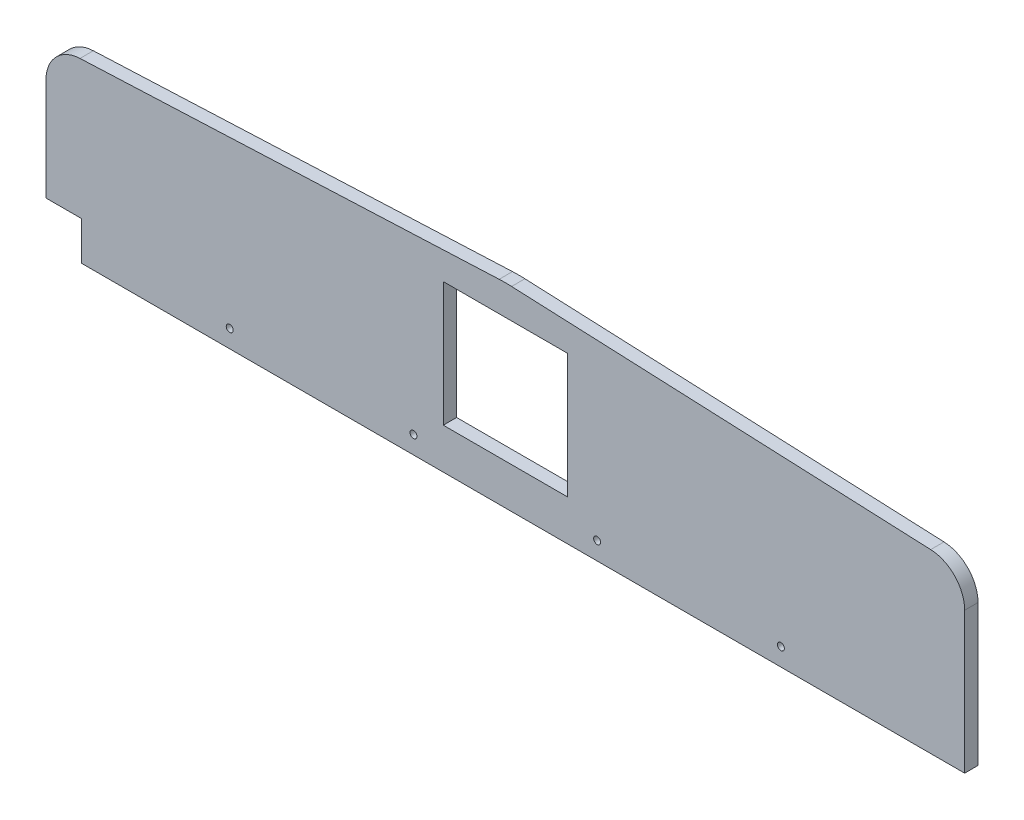
from build123d import *

# Parameters (mm, degrees)
BOSS_EXTRUDE1_DEPTH         = 4.7625
FILLET1_R                   = 25.4
FILLET2_R                   = 101.6
SKETCH3_W                   = 25.4
SKETCH3_H                   = 27.686
CUT_EXTRUDE1_DEPTH          = 370.281286979
SKETCH5_W                   = 88.9
SKETCH5_H                   = 88.9
CUT_EXTRUDE2_DEPTH          = 370.281286979
TAP_DRILL_FOR_M6X1_0_TAP1_D = 5


with BuildPart() as part:
    # Sketch2 → Boss-Extrude1 (new, symmetric)
    with BuildSketch(Plane.XY):
        Polygon((-328.331514278, 55.6895), (-328.331514278, 154.489500012), (0, 168.8465), (328.285794278, 154.489500012), (328.285794278, 55.6895), (328.285794278, 29.289499968), (-328.331514278, 29.289499968), align=None)
    extrude(amount=BOSS_EXTRUDE1_DEPTH, both=True)

    # Fillet1
    fillet1_edges = [part.edges().sort_by_distance(p)[0] for p in [
        (-328.331514278, 154.489500012, 0),
        (328.285794278, 154.489500012, 0),
    ]]
    fillet(fillet1_edges, radius=FILLET1_R)

    # Fillet2
    # the kernel refuses this fillet: 101.6 mm, written as the material it takes off along each edge
    with BuildSketch(Plane(origin=(0, 168.8465, 15.869968436), x_dir=(-0.9990453371749675, -0.04368540109642698, 0), z_dir=(0, 0, -1))) as fillet2_piece_1:
        with BuildLine():
            CenterArc((FILLET2_R * 0.0437301906922, -FILLET2_R), FILLET2_R, 90, 5.00792009)
            Line((-FILLET2_R * 0.0435632568505, -FILLET2_R * 0.00381735910722), (0, 0))
            Line((0, 0), (FILLET2_R * 0.0437301906922, 0))
        make_face()
    extrude(amount=31.739936872, mode=Mode.SUBTRACT)

    # Sketch3 → Cut-Extrude1 (cut, through all)
    with BuildSketch(Plane.XY.offset(4.7625)):
        with Locations((-315.631514278, 43.132499968)):
            Rectangle(SKETCH3_W, SKETCH3_H)
    extrude(amount=-CUT_EXTRUDE1_DEPTH, mode=Mode.SUBTRACT)

    # Sketch5 → Cut-Extrude2 (cut, through all)
    with BuildSketch(Plane.XY.offset(4.7625)):
        with Locations((0.067349574, 102.81865045)):
            Rectangle(SKETCH5_W, SKETCH5_H)
    extrude(amount=-CUT_EXTRUDE2_DEPTH, mode=Mode.SUBTRACT)

    # Tap Drill for M6x1.0 Tap1 (through all)
    with Locations(Plane.XY.offset(4.7625)):
        with Locations((-197.013514278, 41.989499968), (-65.695514278, 41.989499968), (65.622485722, 41.989499968), (196.940485722, 41.989499968)):
            Hole(TAP_DRILL_FOR_M6X1_0_TAP1_D / 2)


solid = part.part
